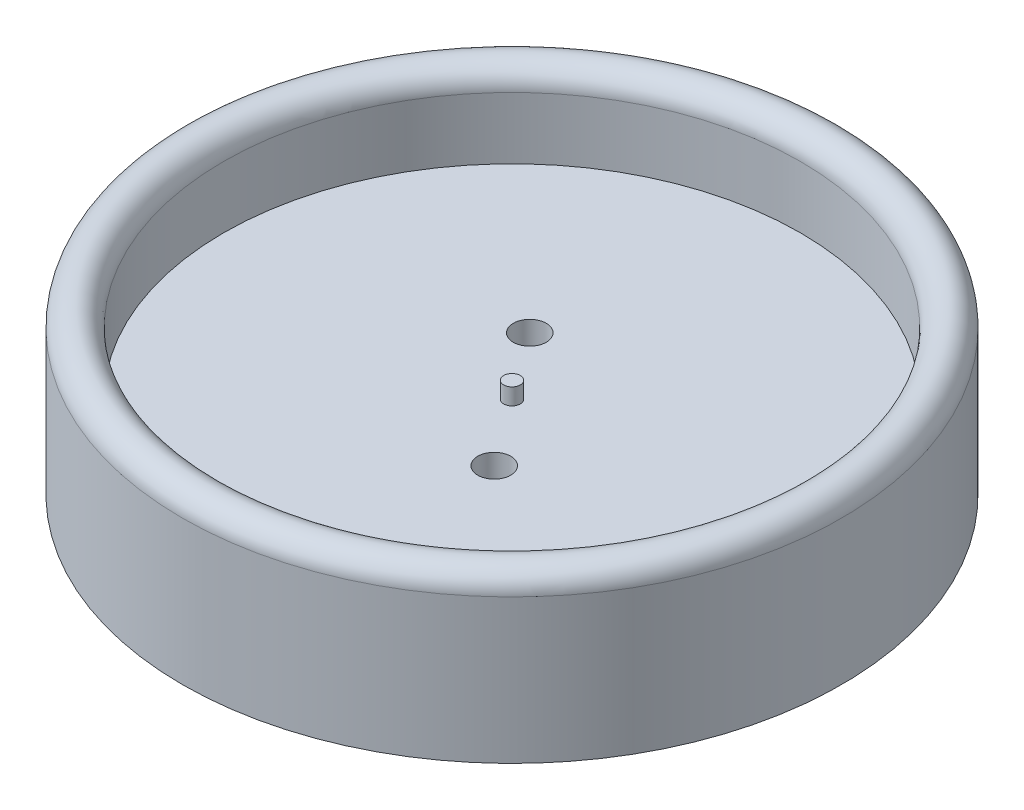
from build123d import *

# Parameters (mm, degrees)
SKETCH_1_R          = 40
EXTRUDE_1_DEPTH     = 10
SKETCH_2_R          = 40
SKETCH_2_R_2        = 35
EXTRUDE_2_DEPTH     = 10
SKETCH_3_R          = 2
CUT_EXTRUDE_1_DEPTH = 20
SKETCH_4_R          = 5
CUT_EXTRUDE_2_DEPTH = 3
FILLET_1_R          = 1.5
FILLET_2_R          = 1.5
FILLET_3_R          = 2.5
SKETCH_5_R          = 1
EXTRUDE_3_DEPTH     = 2


with BuildPart() as part:
    # 草圖1 → 填料-伸長1 (new body)
    with BuildSketch(Plane(origin=(0, 0, 0), x_dir=(1, 0, 0), z_dir=(0, 1, 0))):
        with Locations(Location((0, 0, 0), (0, 0, 270))):
            Circle(SKETCH_1_R)
    extrude(amount=EXTRUDE_1_DEPTH)

    # 草圖2 → 填料-伸長2 (add)
    with BuildSketch(Plane(origin=(0, 10, 0), x_dir=(1, 0, 0), z_dir=(0, 1, 0))):
        with Locations(Location((0, 0, 0), (0, 0, 270))):
            Circle(SKETCH_2_R)
        with Locations(Location((0, 0, 0), (0, 0, 270))):
            Circle(SKETCH_2_R_2, mode=Mode.SUBTRACT)
    extrude(amount=EXTRUDE_2_DEPTH)

    # 草圖3 → 除料-伸長1 (cut)
    with BuildSketch(Plane.XZ):
        with Locations(Location((5.910388913, 8.066430617, 0), (0, 0, 270))):
            Circle(SKETCH_3_R)
        with Locations(Location((-5.910388913, -8.066430617, 0), (0, 0, 270))):
            Circle(SKETCH_3_R)
    extrude(amount=-CUT_EXTRUDE_1_DEPTH, mode=Mode.SUBTRACT)

    # 草圖4 → 除料-伸長2 (cut)
    with BuildSketch(Plane.XZ):
        with Locations(Location((5.910388913, 8.066430617, 0), (0, 0, 270))):
            Circle(SKETCH_4_R)
        with Locations(Location((-5.910388913, -8.066430617, 0), (0, 0, 270))):
            Circle(SKETCH_4_R)
    extrude(amount=-CUT_EXTRUDE_2_DEPTH, mode=Mode.SUBTRACT)

    # 圓角1
    fillet_1_edges = [part.edges().sort_by_distance(p)[0] for p in [
        (-5.910388913, 3, -3.066430617),
        (-5.910388913, 3, -6.066430617),
    ]]
    fillet(fillet_1_edges, radius=FILLET_1_R - 0.0001)  # a hair under: the kernel refuses the full size

    # 圓角2
    fillet_2_edges = [part.edges().sort_by_distance(p)[0] for p in [
        (5.910388913, 3, 13.066430617),
        (5.910388913, 3, 10.066430617),
    ]]
    fillet(fillet_2_edges, radius=FILLET_2_R - 0.0001)  # a hair under: the kernel refuses the full size

    # 圓角3
    fillet_3_edges = [part.edges().sort_by_distance(p)[0] for p in [
        (0, 20, -40),
        (0, 20, -35),
    ]]
    fillet(fillet_3_edges, radius=FILLET_3_R - 0.0001)  # a hair under: the kernel refuses the full size

    # 草圖5 → 填料-伸長3 (add)
    with BuildSketch(Plane(origin=(0, 10, 0), x_dir=(1, 0, 0), z_dir=(0, 1, 0))):
        with Locations(Location((0, 0, 0), (0, 0, 270))):
            Circle(SKETCH_5_R)
    extrude(amount=EXTRUDE_3_DEPTH)


solid = part.part
